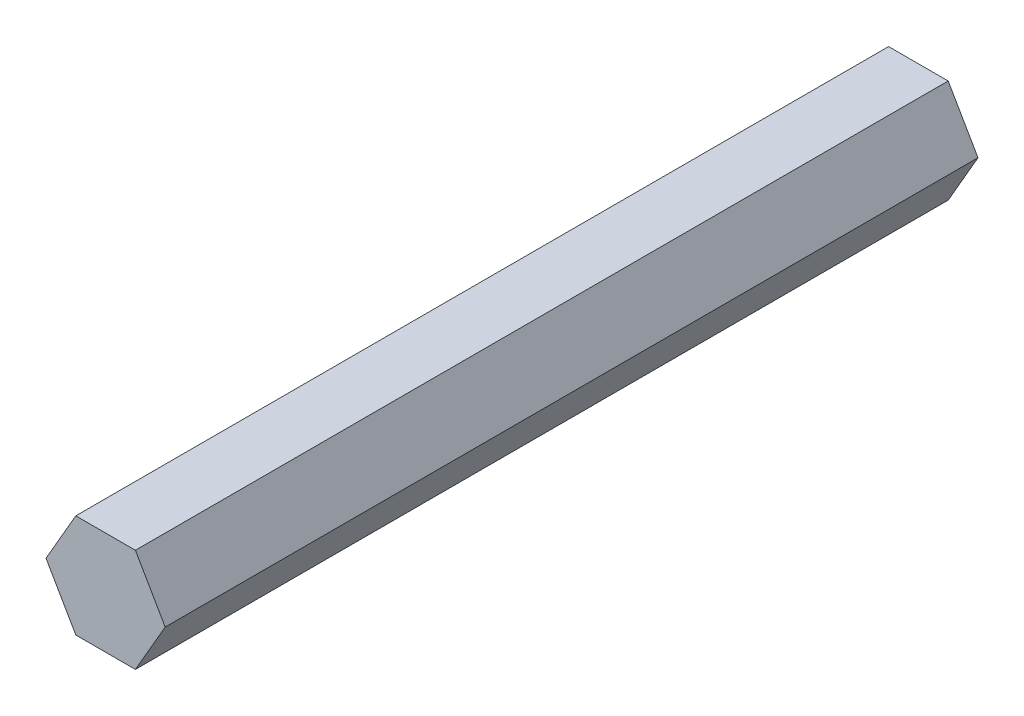
from build123d import *

# Parameters (mm, degrees)
BOSS_EXTRUDE1_DEPTH = 100


with BuildPart() as part:
    # Sketch1 → Boss-Extrude1 (new body)
    with BuildSketch(Plane.XY):
        Polygon((7.332348419, 0), (3.666174209, 6.35), (-3.666174209, 6.35), (-7.332348419, 0), (-3.666174209, -6.35), (3.666174209, -6.35), align=None)
    extrude(amount=BOSS_EXTRUDE1_DEPTH)


solid = part.part
